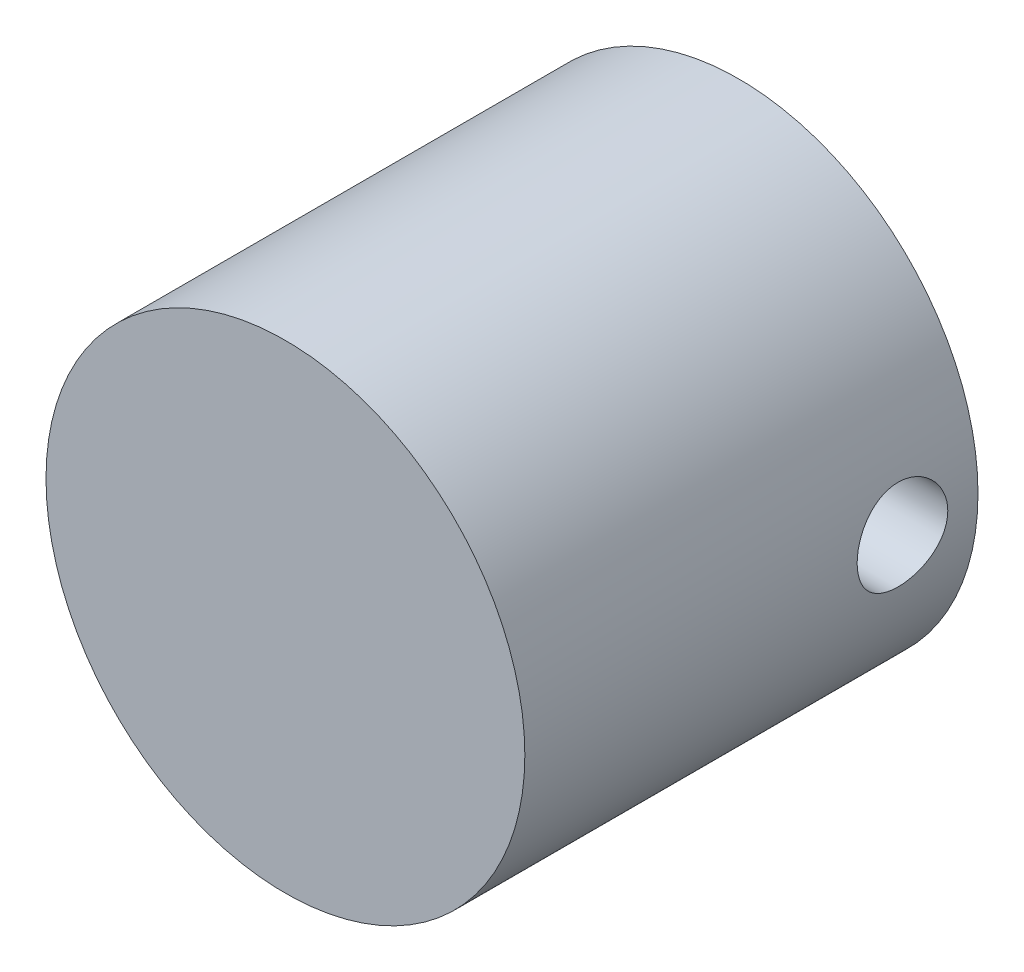
from build123d import *

# Parameters (mm, degrees)
SKETCH1_R               = 7.925
EXTRUDE1_DEPTH          = 15
CUT_EXTRUDE1_DEPTH      = 19.724616151
CUT_EXTRUDE1_DEPTH_BACK = 19.724616151
SKETCH2_R               = 1.5


with BuildPart() as part:
    # Sketch1 → Extrude1 (new body)
    with BuildSketch(Plane.XY):
        Circle(SKETCH1_R)
    extrude(amount=EXTRUDE1_DEPTH)

    # Sketch2 → Cut-Extrude1 (cut, two sides: drawn at the far end of the back side and taken through both)
    with BuildSketch(Plane(origin=(0, 0, 0), x_dir=(0, 0, -1), z_dir=(1, 0, 0)).offset(-CUT_EXTRUDE1_DEPTH_BACK)):
        with Locations((-2.5, 0)):
            Circle(SKETCH2_R)
    extrude(amount=CUT_EXTRUDE1_DEPTH + CUT_EXTRUDE1_DEPTH_BACK, mode=Mode.SUBTRACT)


solid = part.part
